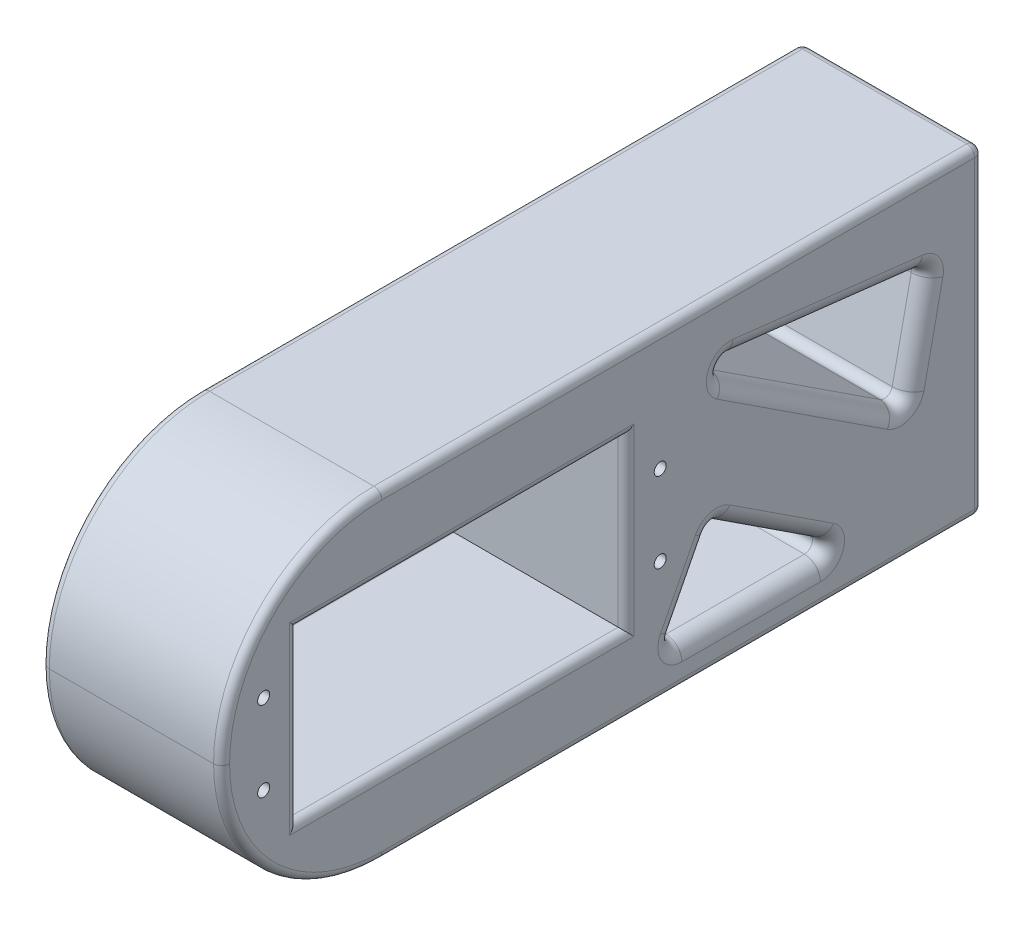
from build123d import *

# Parameters (mm, degrees)
MBODY_DEPTH           = 40
SKETCH5_R             = 0.75
FRONTSCREWS_DEPTH     = 3
SKETCH7_R             = 2.75
GUIDKNOB_DEPTH        = 4
SERVOCUT_DEPTH        = 40.5
ROUNDEND_R            = 20
SKETCH15_R            = 0.75
SERVOSCREWS_DEPTH     = 3
EDGES1MM_R            = 1
MASSREDUCTION_DEPTH   = 25
MASSREDUCTIONFILLET_R = 2
SERVOSCREWS1_START    = -3
SKETCH21_R            = 0.75
SERVOSCREWS1_DEPTH    = 3


with BuildPart() as part:
    # Sketch4 → MBODY (new body)
    with BuildSketch(Plane(origin=(0, 0, 0), x_dir=(1, 0, 0), z_dir=(0, 1, 0))):
        Polygon((-5, 20), (-16.25, 20), (-16.25, -75), (-5, -75), (6.25, -75), (6.25, 20), align=None)
    extrude(amount=MBODY_DEPTH)

    # Sketch5 → FrontScrews (cut)
    with BuildSketch(Plane(origin=(0, 0, -20), x_dir=(-1, 0, 0), z_dir=(0, 0, -1))):
        with Locations((0, 5)):
            Circle(SKETCH5_R)
        with Locations((10, 5)):
            Circle(SKETCH5_R)
        with Locations((10, 15)):
            Circle(SKETCH5_R)
        with Locations((0, 15)):
            Circle(SKETCH5_R)
        with Locations((0, 25)):
            Circle(SKETCH5_R)
        with Locations((10, 25)):
            Circle(SKETCH5_R)
        with Locations((10, 35)):
            Circle(SKETCH5_R)
        with Locations((0, 35)):
            Circle(SKETCH5_R)
    extrude(amount=-FRONTSCREWS_DEPTH, mode=Mode.SUBTRACT)

    # Sketch7 → GUIDKNOB (add)
    with BuildSketch(Plane(origin=(0, 0, -20), x_dir=(-1, 0, 0), z_dir=(0, 0, -1))):
        with Locations((5, 20)):
            Circle(SKETCH7_R)
    extrude(amount=GUIDKNOB_DEPTH)

    # Sketch10 → ServoCut (cut)
    with BuildSketch(Plane(origin=(6.25, 0, 0), x_dir=(0, 0, -1), z_dir=(1, 0, 0))):
        Polygon((-65.5, 20), (-65.5, 30.5), (-24.5, 30.5), (-24.5, 9.5), (-65.5, 9.5), align=None)
    extrude(amount=-SERVOCUT_DEPTH, mode=Mode.SUBTRACT)

    # RoundEnd
    roundend_edges = [part.edges().sort_by_distance(p)[0] for p in [
        (-5, 0, 75),
        (-5, 40, 75),
    ]]
    fillet(roundend_edges, radius=ROUNDEND_R - 0.0001)  # a hair under: the kernel refuses the full size

    # Sketch15 → ServoScrews (cut)
    with BuildSketch(Plane(origin=(6.25, 33.75, 0), x_dir=(0, 1, 0), z_dir=(-1, 0, 0))):
        with Locations(Location((-18.75, -69.75, 0), (0, 0, 270))):
            Circle(SKETCH15_R)
        with Locations(Location((-8.75, -69.75, 0), (0, 0, 270))):
            Circle(SKETCH15_R)
        with Locations(Location((-8.75, -20.25, 0), (0, 0, 270))):
            Circle(SKETCH15_R)
        with Locations(Location((-18.75, -20.25, 0), (0, 0, 270))):
            Circle(SKETCH15_R)
    extrude(amount=SERVOSCREWS_DEPTH, mode=Mode.SUBTRACT)

    # EDGES1MM
    edges1mm_edges = [part.edges().sort_by_distance(p)[0] for p in [
        (-16.25, 20, -20),
        (6.25, 20, -20),
        (6.25, 40, 17.50005),
        (-5, 40, -20),
        (-16.25, 40, 17.50005),
        (6.25, 20, 65.5),
        (6.25, 30.5, 45),
        (-16.25, 20, 24.5),
        (-16.25, 9.5, 45),
        (-16.25, 20, 65.5),
        (-16.25, 30.5, 45),
        (-5, 0, -20),
        (6.25, 9.5, 45),
        (6.25, 20, 24.5),
        (6.25, 0, 17.50005),
        (6.25, 34.142164913, 69.142164913),
        (6.25, 5.857835087, 69.142164913),
        (-16.25, 34.142164913, 69.142164913),
        (-16.25, 5.857835087, 69.142164913),
        (-16.25, 0, 17.50005),
    ]]
    fillet(edges1mm_edges, radius=EDGES1MM_R)

    # Sketch20 → MASSREDUCTION (cut)
    with BuildSketch(Plane.ZY.offset(16.25)):
        with BuildLine():
            Line((-12.215168046, 29.74634987), (11.383359391, 32.473817865))
            ThreePointArc((11.383359391, 32.473817865), (12.438571666, 31.820504762), (12.045296334, 30.643378825))
            Line((12.045296334, 30.643378825), (-9.181519802, 16.768867719))
            ThreePointArc((-9.181519802, 16.768867719), (-10.109863888, 16.681435652), (-10.706749095, 17.397812059))
            Line((-10.706749095, 17.397812059), (-13.078460395, 28.54485517))
            ThreePointArc((-13.078460395, 28.54485517), (-12.91246015, 29.33647319), (-12.215168046, 29.74634987))
        make_face()
        with BuildLine():
            Line((12.659206955, 15.077659132), (-0.290565805, 6.613282524))
            ThreePointArc((-0.290565805, 6.613282524), (-0.701840058, 5.490794018), (0.256557559, 4.776230539))
            Line((0.256557559, 4.776230539), (17.543908561, 4.776230539))
            ThreePointArc((17.543908561, 4.776230539), (18.397154203, 5.254721313), (18.433859511, 6.232286792))
            Line((18.433859511, 6.232286792), (14.09628127, 14.696663401))
            ThreePointArc((14.09628127, 14.696663401), (13.462596051, 15.207213518), (12.659206955, 15.077659132))
        make_face()
    extrude(amount=-MASSREDUCTION_DEPTH, mode=Mode.SUBTRACT)

    # MASSREDUCTIONFILLET
    massreductionfillet_edges = [part.edges().sort_by_distance(p)[0] for p in [
        (6.25, 31.110083867, -0.415904328),
        (6.25, 29.33647319, -12.91246015),
        (6.25, 22.971333615, -11.892604745),
        (6.25, 16.681435652, -10.109863888),
        (6.25, 23.706123272, 1.431888266),
        (6.25, 31.820504762, 12.438571666),
        (6.25, 10.845470828, 6.184320575),
        (6.25, 5.490794018, -0.701840058),
        (6.25, 4.776230539, 8.90023306),
        (6.25, 5.254721313, 18.397154203),
        (6.25, 10.464475096, 16.26507039),
        (6.25, 15.207213518, 13.462596051),
        (-16.25, 15.207213518, 13.462596051),
        (-16.25, 10.845470828, 6.184320575),
        (-16.25, 5.490794018, -0.701840058),
        (-16.25, 4.776230539, 8.90023306),
        (-16.25, 5.254721313, 18.397154203),
        (-16.25, 10.464475096, 16.26507039),
        (-16.25, 31.820504762, 12.438571666),
        (-16.25, 31.110083867, -0.415904328),
        (-16.25, 29.33647319, -12.91246015),
        (-16.25, 22.971333615, -11.892604745),
        (-16.25, 16.681435652, -10.109863888),
        (-16.25, 23.706123272, 1.431888266),
    ]]
    fillet(massreductionfillet_edges, radius=MASSREDUCTIONFILLET_R)

    # Sketch21 → ServoScrews1 (cut)
    with BuildSketch(Plane(origin=(-16.25, 33.75, -16.25), x_dir=(0, 1, 0), z_dir=(-1, 0, 0)).offset(SERVOSCREWS1_START)):
        with Locations(Location((-18.75, -86, 0), (0, 0, 270))):
            Circle(SKETCH21_R)
        with Locations(Location((-8.75, -86, 0), (0, 0, 270))):
            Circle(SKETCH21_R)
        with Locations(Location((-8.75, -36.5, 0), (0, 0, 270))):
            Circle(SKETCH21_R)
        with Locations(Location((-18.75, -36.5, 0), (0, 0, 270))):
            Circle(SKETCH21_R)
    extrude(amount=SERVOSCREWS1_DEPTH, mode=Mode.SUBTRACT)


solid = part.part
